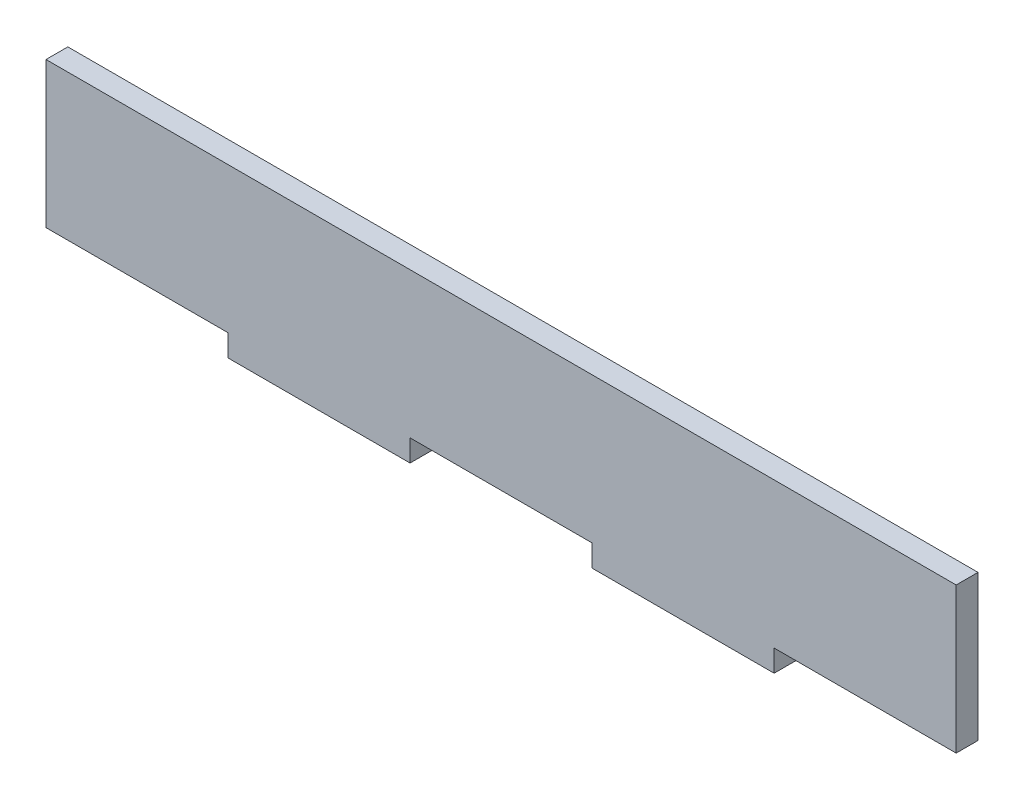
from build123d import *

# Parameters (mm, degrees)
SKETCH1_W           = 250
SKETCH1_H           = 46
BOSS_EXTRUDE1_DEPTH = 6
SKETCH2_W           = 50
SKETCH2_H           = 6
CUT_EXTRUDE1_DEPTH  = 6


with BuildPart() as part:
    # Sketch1 → Boss-Extrude1 (new body)
    with BuildSketch(Plane.XY):
        Rectangle(SKETCH1_W, SKETCH1_H)
    extrude(amount=BOSS_EXTRUDE1_DEPTH)

    # Sketch2 → Cut-Extrude1 (cut)
    with BuildSketch(Plane.XY.offset(6)):
        with Locations((0, -20)):
            Rectangle(SKETCH2_W, SKETCH2_H)
        with Locations((-100, -20)):
            Rectangle(SKETCH2_W, SKETCH2_H)
        with Locations((100, -20)):
            Rectangle(SKETCH2_W, SKETCH2_H)
    extrude(amount=-CUT_EXTRUDE1_DEPTH, mode=Mode.SUBTRACT)


solid = part.part
